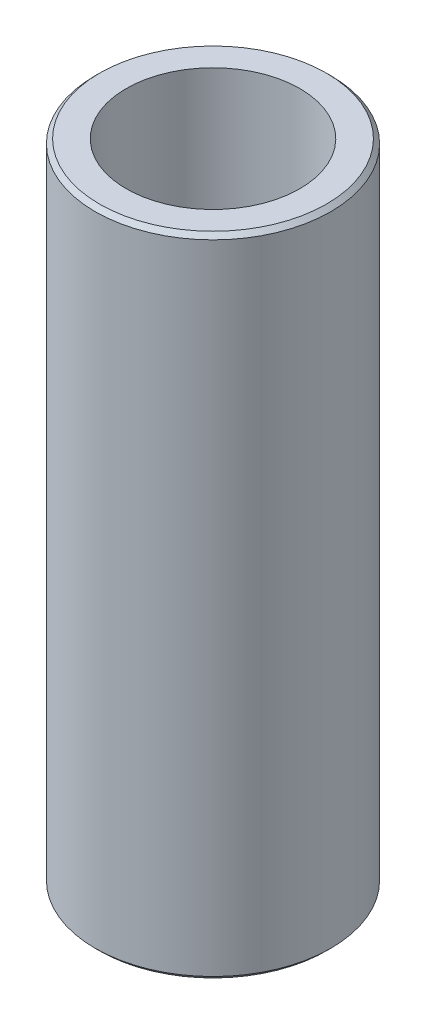
from build123d import *

# Parameters (mm, degrees)
SKETCH1_R           = 40
BOSS_EXTRUDE1_DEPTH = 219.554144355
SKETCH2_R           = 29.478869393
CUT_EXTRUDE1_DEPTH  = 227.724551612
CHAMFER1_SIZE       = 1.485259123


with BuildPart() as part:
    # Sketch1 → Boss-Extrude1 (new body)
    with BuildSketch(Plane(origin=(0, 0, 0), x_dir=(1, 0, 0), z_dir=(0, 1, 0))):
        Circle(SKETCH1_R)
    extrude(amount=BOSS_EXTRUDE1_DEPTH)

    # Sketch2 → Cut-Extrude1 (cut, through all)
    with BuildSketch(Plane(origin=(0, 0, 0), x_dir=(1, 0, 0), z_dir=(0, 1, 0))):
        Circle(SKETCH2_R)
    extrude(amount=CUT_EXTRUDE1_DEPTH, mode=Mode.SUBTRACT)

    # Chamfer1
    chamfer1_edges = [part.edges().sort_by_distance(p)[0] for p in [
        (-40, 219.554144355, 0),
        (-40, 0, 0),
    ]]
    chamfer(chamfer1_edges, length=CHAMFER1_SIZE)


solid = part.part
